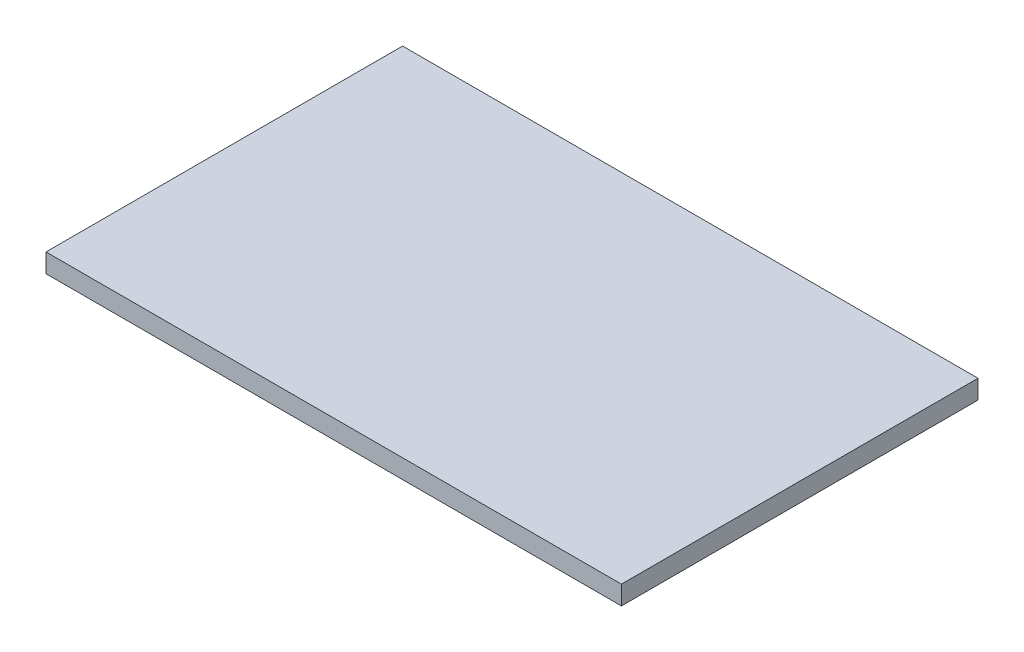
from build123d import *

# Parameters (mm, degrees)
SKETCH1_W           = 96.82
SKETCH1_H           = 60
BOSS_EXTRUDE1_DEPTH = 3.18


with BuildPart() as part:
    # Sketch1 → Boss-Extrude1 (new body)
    with BuildSketch(Plane(origin=(0, 0, 0), x_dir=(1, 0, 0), z_dir=(0, 1, 0))):
        Rectangle(SKETCH1_W, SKETCH1_H)
    extrude(amount=BOSS_EXTRUDE1_DEPTH)


solid = part.part
